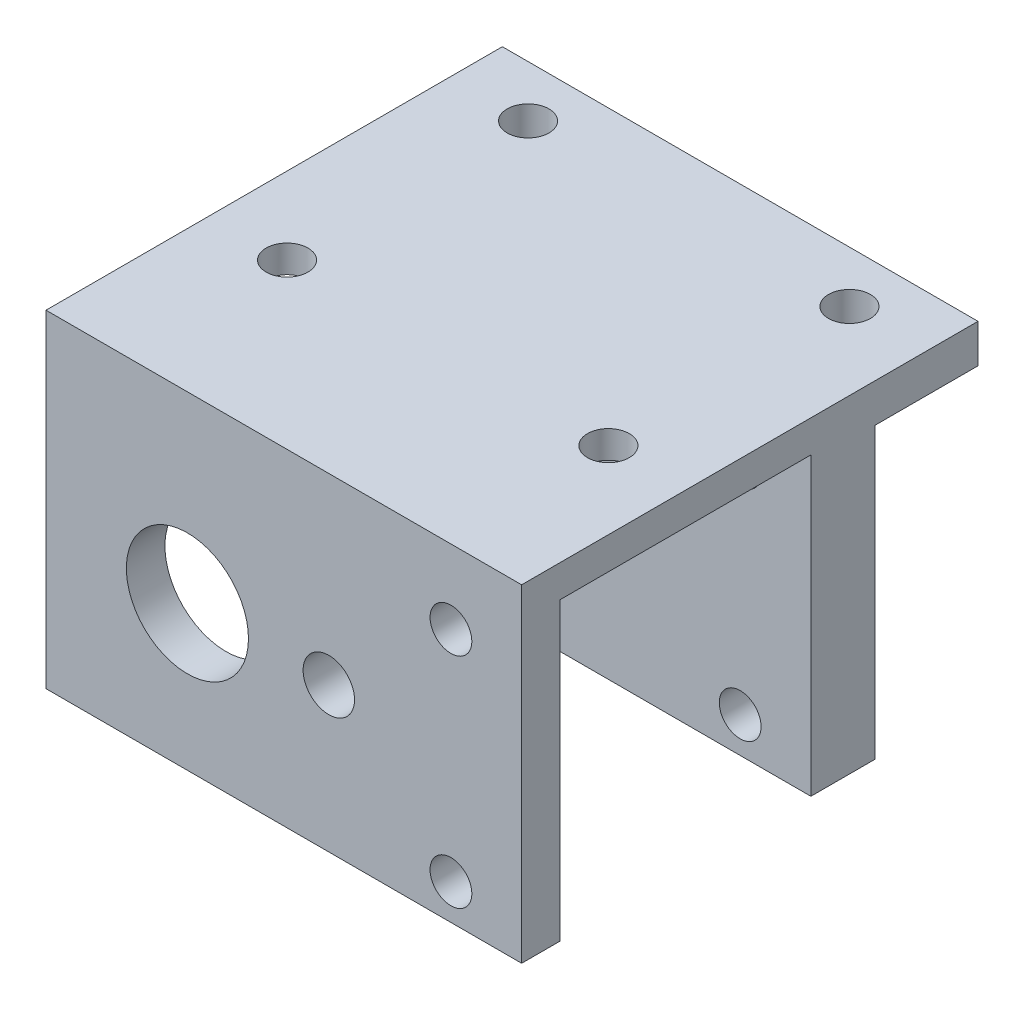
from build123d import *

# Parameters (mm, degrees)
BOSS_EXTRUDE1_OUTLINE_W   = 37
BOSS_EXTRUDE1_OUTLINE_H   = 22.5
BOSS_EXTRUDE1_OUTLINE_R   = 1.625
BOSS_EXTRUDE1_OUTLINE_R_2 = 4.75
BOSS_EXTRUDE1_OUTLINE_R_3 = 2
BOSS_EXTRUDE1_DEPTH       = 3
SKETCH2_W                 = 37
SKETCH2_H                 = 22.5
SKETCH2_R                 = 1.625
BOSS_EXTRUDE2_DEPTH       = 5
SKETCH3_W                 = 37
SKETCH3_H                 = 35.5
BOSS_EXTRUDE3_DEPTH       = 3
BOSS_EXTRUDE4_DEPTH       = 37
CUT_EXTRUDE1_DEPTH        = 10
CUT_EXTRUDE2_REACH        = 57.457
SKETCH7_R                 = 1.625
CHAMFER1_SIZE             = 1.5
CHAMFER1_SIZE2            = 0.866025404
FILLET1_R                 = 10
SKETCH8_R                 = 3.5
CUT_EXTRUDE3_DEPTH        = 22.5
SKETCH9_W                 = 37
SKETCH9_H                 = 19.5
CUT_EXTRUDE4_DEPTH        = 0.5


# Read off the part's stored shape, not the designer's step: Boss-Extrude1
with BuildPart() as part:
    # Boss-Extrude1 outline → Boss-Extrude1 (new body)
    with BuildSketch(Plane.XY):
        with Locations((18.5, 11.25)):
            Rectangle(BOSS_EXTRUDE1_OUTLINE_W, BOSS_EXTRUDE1_OUTLINE_H)
        with Locations((31.5, 2.75)):
            Circle(BOSS_EXTRUDE1_OUTLINE_R, mode=Mode.SUBTRACT)
        with Locations((11, 11.25)):
            Circle(BOSS_EXTRUDE1_OUTLINE_R_2, mode=Mode.SUBTRACT)
        with Locations((22, 11.25)):
            Circle(BOSS_EXTRUDE1_OUTLINE_R_3, mode=Mode.SUBTRACT)
        with Locations((31.5, 19.75)):
            Circle(BOSS_EXTRUDE1_OUTLINE_R, mode=Mode.SUBTRACT)
    extrude(amount=BOSS_EXTRUDE1_DEPTH)



with BuildPart() as body_2:
    # Sketch2 → Boss-Extrude2 (new body)
    with BuildSketch(Plane(origin=(0, 0, -19.5), x_dir=(-1, 0, 0), z_dir=(0, 0, -1))):
        with Locations((-18.5, 11.25)):
            Rectangle(SKETCH2_W, SKETCH2_H)
        with Locations((-31.5, 2.75)):
            Circle(SKETCH2_R, mode=Mode.SUBTRACT)
        with Locations(Location((-31.5, 19.75, 0), (0, 0, 180))):
            Circle(SKETCH2_R, mode=Mode.SUBTRACT)
    extrude(amount=BOSS_EXTRUDE2_DEPTH)


with BuildPart() as part_1:
    add(part.part)

    add(body_2.part)  # Boss-Extrude3 merges body 2
    # Sketch3 → Boss-Extrude3 (add)
    with BuildSketch(Plane.XZ.offset(-22.5)):
        with Locations((18.5, -14.75)):
            Rectangle(SKETCH3_W, SKETCH3_H)
    extrude(amount=-BOSS_EXTRUDE3_DEPTH)

    # Sketch6 → Boss-Extrude4 (add)
    with BuildSketch(Plane(origin=(37, 0, 0), x_dir=(0, 0, -1), z_dir=(1, 0, 0))):
        Polygon((32.5, 22.5), (24.5, 11.25), (24.5, 22.5), align=None)
    extrude(amount=-BOSS_EXTRUDE4_DEPTH)

    # Sketch6<2> → Cut-Extrude1 (cut)
    with BuildSketch(Plane(origin=(37, 0, 0), x_dir=(0, 0, -1), z_dir=(1, 0, 0))):
        Polygon((32.5, 22.5), (24.5, 11.25), (24.5, 22.5), align=None)
    extrude(amount=-CUT_EXTRUDE1_DEPTH, mode=Mode.SUBTRACT)

    # Sketch7 → Cut-Extrude2 (cut, up to next)
    with BuildSketch(Plane(origin=(0, 25.5, 0), x_dir=(-1, 0, 0), z_dir=(0, 1, 0)), mode=Mode.PRIVATE) as cut_extrude2_sk1:
        with Locations(Location((-6, -9.75, 0), (0, 0, 90))):
            Circle(SKETCH7_R)
    cut_extrude2_tool1 = extrude(cut_extrude2_sk1.sketch, amount=-CUT_EXTRUDE2_REACH, mode=Mode.PRIVATE) & part_1.part
    # Sketch7 → Cut-Extrude2 (cut, up to next)
    with BuildSketch(Plane(origin=(0, 25.5, 0), x_dir=(-1, 0, 0), z_dir=(0, 1, 0)), mode=Mode.PRIVATE) as cut_extrude2_sk2:
        with Locations(Location((-31, -9.75, 0), (0, 0, 90))):
            Circle(SKETCH7_R)
    cut_extrude2_tool2 = extrude(cut_extrude2_sk2.sketch, amount=-CUT_EXTRUDE2_REACH, mode=Mode.PRIVATE) & part_1.part
    # Sketch7 → Cut-Extrude2 (cut, up to next)
    with BuildSketch(Plane(origin=(0, 25.5, 0), x_dir=(-1, 0, 0), z_dir=(0, 1, 0)), mode=Mode.PRIVATE) as cut_extrude2_sk3:
        with Locations(Location((-6, -28.5, 0), (0, 0, 90))):
            Circle(SKETCH7_R)
    cut_extrude2_tool3 = extrude(cut_extrude2_sk3.sketch, amount=-CUT_EXTRUDE2_REACH, mode=Mode.PRIVATE) & part_1.part
    # Sketch7 → Cut-Extrude2 (cut, up to next)
    with BuildSketch(Plane(origin=(0, 25.5, 0), x_dir=(-1, 0, 0), z_dir=(0, 1, 0)), mode=Mode.PRIVATE) as cut_extrude2_sk4:
        with Locations(Location((-31, -28.5, 0), (0, 0, 90))):
            Circle(SKETCH7_R)
    cut_extrude2_tool4 = extrude(cut_extrude2_sk4.sketch, amount=-CUT_EXTRUDE2_REACH, mode=Mode.PRIVATE) & part_1.part
    add(cut_extrude2_tool1.solids().sort_by_distance((6, 25.5, -9.75))[0], mode=Mode.SUBTRACT)
    add(cut_extrude2_tool2.solids().sort_by_distance((31, 25.5, -9.75))[0], mode=Mode.SUBTRACT)
    add(cut_extrude2_tool3.solids().sort_by_distance((6, 25.5, -28.5))[0], mode=Mode.SUBTRACT)
    add(cut_extrude2_tool4.solids().sort_by_distance((31, 25.5, -28.5))[0], mode=Mode.SUBTRACT)

    # Chamfer1
    chamfer1_edges = [part_1.edges().sort_by_distance(p)[0] for p in [
        (31, 22.5, -11.375),
        (6, 22.5, -11.375),
    ]]
    chamfer1_side = [part_1.faces().sort_by_distance(p)[0] for p in [
        (18.5, 22.5, -9.75),
    ]]
    chamfer(chamfer1_edges, length=CHAMFER1_SIZE, length2=CHAMFER1_SIZE2, reference=chamfer1_side[0])

    # Fillet1
    fillet1_edges = [part_1.edges().sort_by_distance(p)[0] for p in [
        (13.5, 11.25, -24.5),
    ]]
    fillet(fillet1_edges, radius=FILLET1_R)

    # Sketch8 → Cut-Extrude3 (cut)
    with BuildSketch(Plane(origin=(0, 0, 0), x_dir=(1, 0, 0), z_dir=(0, 1, 0))):
        with Locations(Location((6, 28.5, 0), (0, 0, 322.109230385))):
            Circle(SKETCH8_R)
    extrude(amount=CUT_EXTRUDE3_DEPTH, mode=Mode.SUBTRACT)

    # Sketch9 → Cut-Extrude4 (cut)
    with BuildSketch(Plane(origin=(0, 22.5, 0), x_dir=(-1, 0, 0), z_dir=(0, -1, 0))):
        with Locations((-18.5, 9.75)):
            Rectangle(SKETCH9_W, SKETCH9_H)
    extrude(amount=-CUT_EXTRUDE4_DEPTH, mode=Mode.SUBTRACT)


solid = part_1.part
